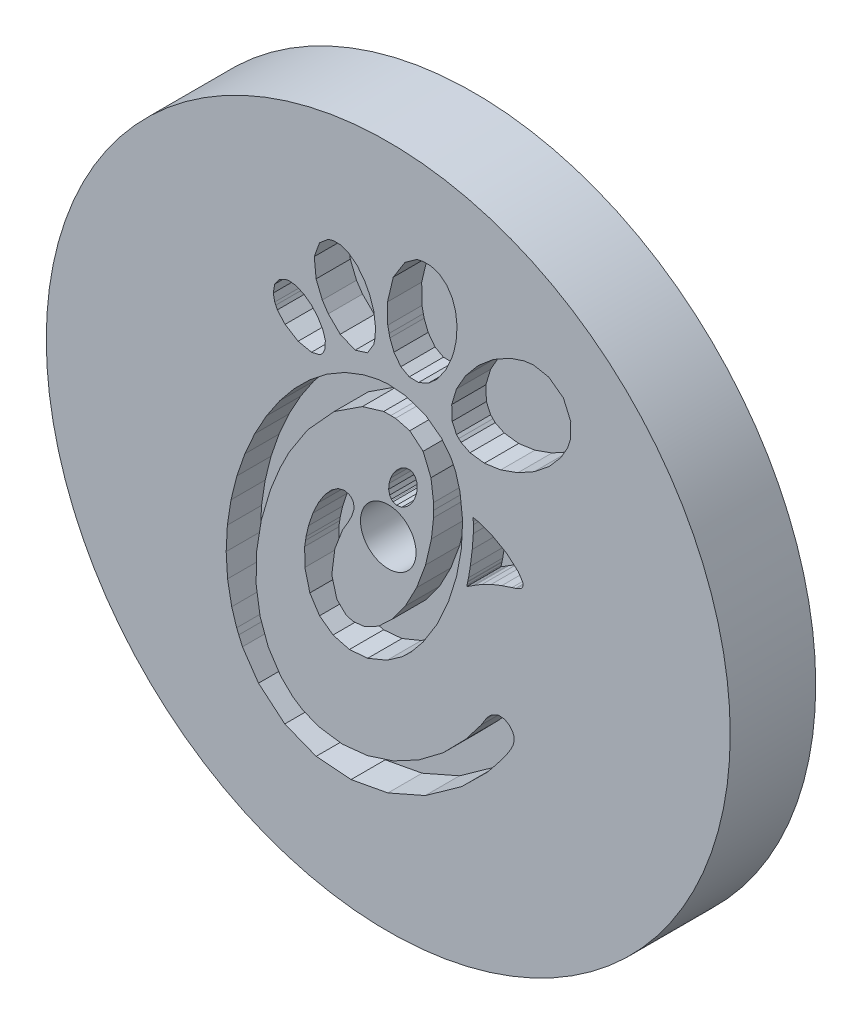
from build123d import *

# Parameters (mm, degrees)
SKETCH3_R           = 40
BOSS_EXTRUDE1_DEPTH = 10
CUT_EXTRUDE1_START  = -4
CUT_EXTRUDE1_DEPTH  = 4
SKETCH5_R           = 1.8
CUT_EXTRUDE2_DEPTH  = 80.355196638
CUT_EXTRUDE3_START  = -10
SKETCH6_R           = 3.25
CUT_EXTRUDE3_DEPTH  = 5


# Read off the part's stored shape, not the designer's step: Cut-Extrude1
with BuildPart() as part:
    # Sketch3 → Boss-Extrude1 (new body)
    with BuildSketch(Plane.XY):
        with Locations((15.986818175, 15.341877671)):
            Circle(SKETCH3_R)
    extrude(amount=-BOSS_EXTRUDE1_DEPTH)

    # Cut-Extrude1 outline → Cut-Extrude1 (cut)
    with BuildSketch(Plane.XY.offset(CUT_EXTRUDE1_START)):
        Polygon((20.989981161, 45.253414519), (20.114941161, 45.263734519), (19.836301161, 45.204934519), (19.325581161, 45.099814519), (17.937661161, 44.097094519), (16.571821161, 41.920054519), (15.901261161, 39.081334519), (15.928621161, 36.735094519), (16.092541161, 35.986294519), (16.183981161, 35.571094519), (16.653901161, 34.366774519), (17.461261161, 33.294934519), (18.441661161, 32.754694519), (19.528861161, 32.732374519), (20.652541161, 33.215734519), (21.740941161, 34.187014519), (22.726621161, 35.632294519), (23.377981161, 37.049014519), (23.539261161, 37.538374519), (23.669581161, 37.934374519), (23.931181161, 39.164614519), (24.032461161, 40.696054519), (23.865901161, 42.085414519), (23.455981161, 43.284694519), (22.824301161, 44.243974519), (21.993661161, 44.915974519), align=None)
        Polygon((26.092621161, 22.210294519), (25.899901161, 22.242934519), (25.933981161, 21.852454519), (25.959901161, 21.552694519), (25.937581161, 20.631094519), (25.811101161, 18.964294519), (25.584781161, 17.144134519), (25.377901161, 15.879814519), (25.289101161, 15.461734519), (25.272301161, 15.386134519), (25.209901161, 15.068374519), (25.182541161, 14.898934519), (25.184941161, 14.896294519), (25.186141161, 14.895334519), (25.382941161, 15.009814519), (25.753981161, 15.246694519), (25.842541161, 15.304054519), (26.115901161, 15.485014519), (26.958541161, 15.994054519), (28.035181161, 16.538374519), (29.269501161, 17.026774519), (30.459901161, 17.422774519), (30.859501161, 17.544934519), (31.033981161, 17.599654519), (31.558861161, 17.857414519), (31.733101161, 18.200134519), (31.731901161, 18.294934519), (31.727821161, 18.573814519), (31.188781161, 19.403014519), (29.829661161, 20.590774519), (28.010461161, 21.610054519), (26.582221161, 22.129654519), align=None)
        Polygon((18.507901161, 23.378374519), (18.145981161, 23.354614519), (18.035101161, 23.318374519), (17.886781161, 23.271334519), (17.474221161, 23.033494519), (16.979101161, 22.588054519), (16.569181161, 22.030774519), (16.263181161, 21.410614519), (16.079581161, 20.774134519), (16.035181161, 20.168614519), (16.151101161, 19.641334519), (16.351501161, 19.318294519), (16.445581161, 19.241734519), (16.549501161, 19.155814519), (16.968781161, 19.017814519), (17.562541161, 19.104694519), (18.171901161, 19.486294519), (18.621181161, 19.959094519), (18.743581161, 20.135974519), (18.843901161, 20.283334519), (19.091101161, 20.760934519), (19.299661161, 21.387334519), (19.376461161, 21.981094519), (19.328221161, 22.509814519), (19.162861161, 22.940614519), (18.886861161, 23.241814519), align=None)
        Polygon((10.394461161, 42.108694519), (9.602941161, 42.126934519), (9.360781161, 42.059254519), (8.970301161, 41.951494519), (7.946941161, 41.093014519), (7.332301161, 39.386134519), (7.546861161, 37.235014519), (8.274781161, 35.459014519), (8.975581161, 34.407094519), (10.368541161, 33.038374519), (12.113581161, 32.298934519), (13.552141161, 32.747974519), (14.302141161, 33.971974519), (14.385661161, 34.410694519), (14.451901161, 34.770454519), (14.488621161, 35.877094519), (14.290621161, 37.337974519), (13.837261161, 38.724694519), (13.173181161, 39.965734519), (12.347821161, 40.990294519), (11.406541161, 41.728774519), align=None)
        Polygon((34.757821161, 40.892614519), (32.979181161, 41.228614519), (32.410141161, 41.155654519), (31.869901161, 41.087974519), (30.291901161, 40.569814519), (28.287901161, 39.446134519), (26.500141161, 37.929094519), (25.024861161, 36.160774519), (23.961181161, 34.283494519), (23.408941161, 32.438134519), (23.466301161, 30.766294519), (23.967661161, 29.676454519), (24.233101161, 29.410774519), (24.496141161, 29.148934519), (25.550941161, 28.628374519), (27.234541161, 28.407094519), (29.143261161, 28.683094519), (31.134301161, 29.392774519), (33.067981161, 30.469414519), (34.802221161, 31.852294519), (36.195421161, 33.474694519), (36.949261161, 34.799974519), (37.108141161, 35.272774519), (37.293181161, 35.828614519), (37.333501161, 37.668694519), (36.474301161, 39.635974519), align=None)
        Polygon((17.992141161, 30.637414519), (16.010461161, 30.795094519), (15.360781161, 30.732454519), (14.793181161, 30.678934519), (13.112221161, 30.299014519), (10.932541161, 29.452294519), (8.838541161, 28.235014519), (6.852781161, 26.684374519), (4.993501161, 24.843094519), (3.280141161, 22.748134519), (1.731901161, 20.440774519), (0.369901161, 17.961814519), (-0.786418839, 15.348454519), (-1.718338839, 12.641254519), (-2.406178839, 9.879814519), (-2.830498839, 7.104694519), (-2.969698839, 4.355974519), (-2.807218839, 1.671334519), (-2.320018839, -0.906745481), (-1.743538839, -2.751865481), (-1.490818839, -3.341785481), (-1.063858839, -4.340425481), (0.809821161, -7.085305481), (3.885661161, -9.675097481), (7.553581161, -11.122993481), (11.635501161, -11.438089481), (15.950461161, -10.632121481), (20.317981161, -8.714185481), (24.556141161, -5.695945481), (27.601501161, -2.694505481), (28.485901161, -1.589065481), (28.683901161, -1.340425481), (29.265901161, -0.587785481), (29.869981161, 0.246694519), (30.306301161, 0.939334519), (30.583501161, 1.516294519), (30.713581161, 2.002054519), (30.703261161, 2.420134519), (30.563821161, 2.796454519), (30.377821161, 3.072454519), (30.306301161, 3.154294519), (30.166861161, 3.312934519), (29.602861161, 3.658294519), (28.832221161, 3.714454519), (28.066621161, 3.339334519), (27.518221161, 2.766454519), (27.381661161, 2.546374519), (26.859421161, 1.713094519), (25.053421161, -0.639865481), (22.408861161, -3.335305481), (19.545421161, -5.495305481), (16.561261161, -7.081225481), (13.553581161, -8.048905481), (10.623901161, -8.357305481), (7.867261161, -7.964185481), (5.948221161, -7.197145481), (5.385661161, -6.827305481), (4.846621161, -6.471865481), (3.429901161, -5.103385481), (1.966141161, -2.880745481), (1.000141161, -0.229705481), (0.536461161, 2.777974519), (0.579661161, 6.068374519), (1.134301161, 9.568294519), (2.204461161, 13.207654519), (3.347821161, 16.011094519), (3.798301161, 16.910614519), (4.386781161, 18.091654519), (6.546781161, 21.437014519), (9.655261161, 24.849814519), (12.957181161, 27.005974519), (15.451981161, 27.758374519), (16.285261161, 27.759814519), (16.838461161, 27.761014519), (18.502861161, 27.334054519), (20.062621161, 26.027974519), (20.983261161, 23.813014519), (21.285181161, 21.448774519), (21.285181161, 20.660614519), (21.283981161, 19.907014519), (21.036541161, 17.641414519), (20.350621161, 14.657014519), (19.304941161, 11.839414519), (17.983261161, 9.318454519), (16.462141161, 7.224694519), (14.824141161, 5.689414519), (13.148461161, 4.840774519), (11.895901161, 4.709014519), (11.517181161, 4.809334519), (11.084941161, 4.924054519), (9.980461161, 5.982454519), (9.382861161, 8.177734519), (9.740941161, 11.006134519), (10.647181161, 13.365334519), (11.073181161, 14.078614519), (11.242141161, 14.365414519), (11.698141161, 15.256054519), (11.981821161, 16.134694519), (11.933821161, 16.774054519), (11.675821161, 17.146294519), (11.561101161, 17.229814519), (11.418301161, 17.333974519), (10.864861161, 17.470774519), (10.102861161, 17.283334519), (9.313981161, 16.721974519), (8.535181161, 15.838054519), (7.807501161, 14.685814519), (7.168141161, 13.315654519), (6.657421161, 11.782054519), (6.373981161, 10.551334519), (6.313981161, 10.136134519), (6.213421161, 9.452374519), (6.235981161, 7.353814519), (6.817981161, 5.062054519), (7.951981161, 3.311974519), (9.530221161, 2.155654519), (11.444221161, 1.643974519), (13.587181161, 1.827334519), (15.851581161, 2.759734519), (17.615821161, 4.000774519), (18.130141161, 4.490374519), (18.660301161, 4.996774519), (20.063821161, 6.714454519), (21.704461161, 9.340774519), (23.018221161, 12.245254519), (23.974141161, 15.299014519), (24.540541161, 18.375814519), (24.684781161, 21.345814519), (24.377821161, 24.083974519), (23.856781161, 25.902934519), (23.586301161, 26.461654519), (23.324221161, 27.000694519), (22.199101161, 28.453654519), (20.303581161, 29.861494519), align=None)
        Polygon((5.134141161, 35.390134519), (4.401181161, 35.471974519), (4.169581161, 35.431654519), (3.932461161, 35.391334519), (3.263101161, 35.033494519), (2.703181161, 34.283494519), (2.540461161, 33.302614519), (2.707261161, 32.465734519), (2.826781161, 32.215654519), (3.013261161, 31.824934519), (3.921901161, 30.816934519), (5.448301161, 29.868934519), (7.007821161, 29.535814519), (8.002861161, 29.775334519), (8.208541161, 29.979814519), (8.347981161, 30.120454519), (8.606941161, 30.701494519), (8.621101161, 31.582774519), (8.313901161, 32.538454519), (7.748941161, 33.480934519), (6.987181161, 34.328614519), (6.095101161, 34.992934519), align=None)
    extrude(amount=CUT_EXTRUDE1_DEPTH, mode=Mode.SUBTRACT)

    # Sketch5 → Cut-Extrude2 (cut, through all)
    with BuildSketch(Plane(origin=(0, 0, -10), x_dir=(-1, 0, 0), z_dir=(0, 0, -1))):
        with Locations((-15.986818175, 15.341877671)):
            Circle(SKETCH5_R)
    extrude(amount=-CUT_EXTRUDE2_DEPTH, mode=Mode.SUBTRACT)

    # Sketch6 → Cut-Extrude3 (cut)
    with BuildSketch(Plane(origin=(0, 0, -10), x_dir=(-1, 0, 0), z_dir=(0, 0, -1)).offset(CUT_EXTRUDE3_START)):
        with Locations(Location((-15.986818175, 15.341877671, 0), (0, 0, 180))):
            Circle(SKETCH6_R)
    extrude(amount=CUT_EXTRUDE3_DEPTH, mode=Mode.SUBTRACT)


solid = part.part
